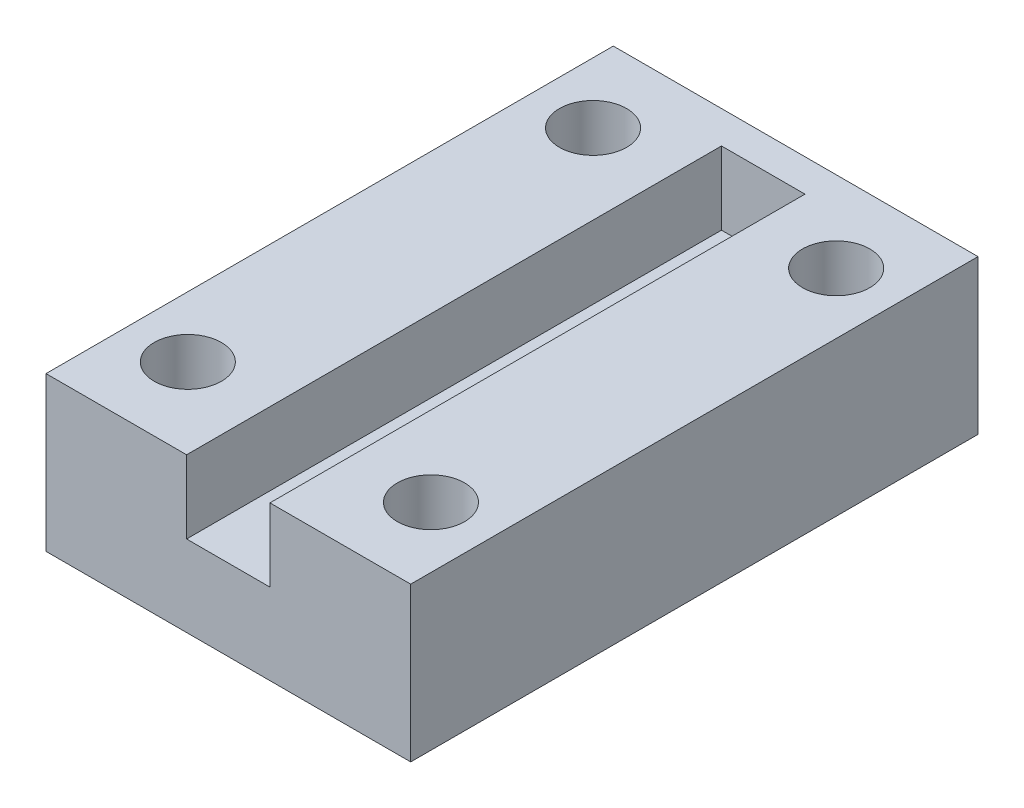
from build123d import *

# Parameters (mm, degrees)
SKETCH1_W           = 45
SKETCH1_H           = 70
BOSS_EXTRUDE1_DEPTH = 10
SKETCH3_R           = 4.15
CUT_EXTRUDE2_DEPTH  = 43.793106922
SKETCH5_R           = 4.15
BOSS_EXTRUDE2_DEPTH = 9
CHAMFER1_SIZE       = 1
CHAMFER1_SIZE2      = 1.191753593


with BuildPart() as part:
    # Sketch1 → Boss-Extrude1 (new body)
    with BuildSketch(Plane(origin=(0, 0, 0), x_dir=(1, 0, 0), z_dir=(0, 1, 0))):
        Rectangle(SKETCH1_W, SKETCH1_H)
    extrude(amount=BOSS_EXTRUDE1_DEPTH)

    # Sketch3 → Cut-Extrude2 (cut, through all)
    with BuildSketch(Plane.XZ):
        with Locations((15, 25)):
            Circle(SKETCH3_R)
        with Locations((15, -25)):
            Circle(SKETCH3_R)
        with Locations((-15, -25)):
            Circle(SKETCH3_R)
        with Locations((-15, 25)):
            Circle(SKETCH3_R)
    extrude(amount=-CUT_EXTRUDE2_DEPTH, mode=Mode.SUBTRACT)

    # Sketch5 → Boss-Extrude2 (add)
    with BuildSketch(Plane(origin=(0, 10, 0), x_dir=(1, 0, 0), z_dir=(0, 1, 0))):
        Polygon((-5.15, -35), (-22.5, -35), (-22.5, 35), (22.5, 35), (22.5, -35), (5.15, -35), (5.130229348, -34.949305848), (5.15, 31), (-5.15, 31), align=None)
        with Locations((-15, 25)):
            Circle(SKETCH5_R, mode=Mode.SUBTRACT)
        with Locations((15, 25)):
            Circle(SKETCH5_R, mode=Mode.SUBTRACT)
        with Locations((15, -25)):
            Circle(SKETCH5_R, mode=Mode.SUBTRACT)
        with Locations((-15, -25)):
            Circle(SKETCH5_R, mode=Mode.SUBTRACT)
    extrude(amount=BOSS_EXTRUDE2_DEPTH)

    # Chamfer1
    chamfer1_edges = [part.edges().sort_by_distance(p)[0] for p in [
        (10.85, 0, 25),
        (-19.15, 0, 25),
        (-19.15, 0, -25),
        (10.85, 0, -25),
    ]]
    chamfer1_side = [part.faces().sort_by_distance(p)[0] for p in [
        (0, 0, 0),
    ]]
    chamfer(chamfer1_edges, length=CHAMFER1_SIZE, length2=CHAMFER1_SIZE2, reference=chamfer1_side[0])


solid = part.part
